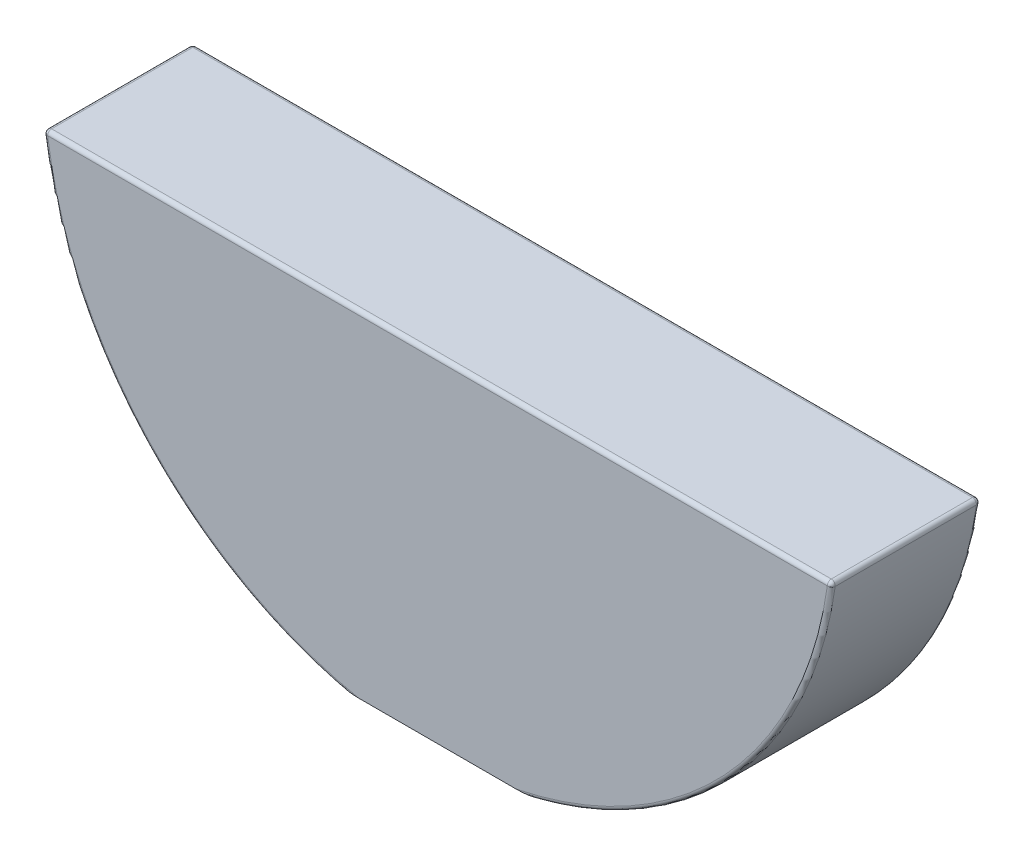
from build123d import *

# Parameters (mm, degrees)
EXTRUDE1_DEPTH          = 4.7625
FILLET3_R               = 0.127
CUT_EXTRUDE2_DEPTH      = 19.499943496
CUT_EXTRUDE2_DEPTH_BACK = 19.499943496


with BuildPart() as part:
    # Sketch1 → Extrude1 (new body)
    with BuildSketch(Plane.XY):
        with BuildLine():
            Line((-12.598784067, -1.6002), (12.598784067, -1.6002))
            ThreePointArc((12.598784067, -1.6002), (0, -12.7), (-12.598784067, -1.6002))
        make_face()
    extrude(amount=EXTRUDE1_DEPTH)

    # Fillet3
    fillet3_edges = [part.edges().sort_by_distance(p)[0] for p in [
        (12.598784067, -1.6002, 2.38125),
        (-12.598784067, -1.6002, 2.38125),
        (0, -1.6002, 4.7625),
        (0, -12.7, 4.7625),
        (0, -1.6002, 0),
        (0, -12.7, 0),
    ]]
    fillet(fillet3_edges, radius=FILLET3_R)

    # Sketch3 → Cut-Extrude2 (cut, two sides: drawn at the far end of the back side and taken through both)
    with BuildSketch(Plane.XY.offset(-CUT_EXTRUDE2_DEPTH_BACK)):
        Polygon((-189.36155496, -12.319), (-50.8, -12.319), (50.8, -12.319), (189.36155496, -12.319), (189.36155496, -289.44210992), (-189.36155496, -289.44210992), align=None)
    extrude(amount=CUT_EXTRUDE2_DEPTH + CUT_EXTRUDE2_DEPTH_BACK, mode=Mode.SUBTRACT)


solid = part.part
